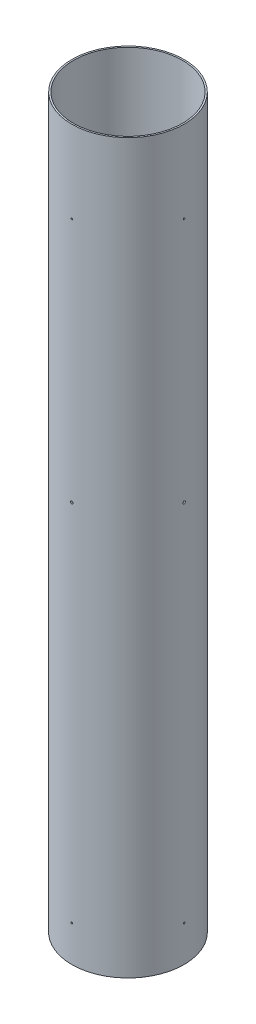
from build123d import *

# Parameters (mm, degrees)
SKETCH1_R           = 78.359
SKETCH1_R_2         = 76.1746
BOSS_EXTRUDE1_DEPTH = 1016
SKETCH3_R           = 1.750000056
SKETCH3_R_2         = 1.0922
CUT_EXTRUDE1_DEPTH  = 1023.025570014
CIRPATTERN1_COUNT   = 4


with BuildPart() as part:
    # Sketch1 → Boss-Extrude1 (new body)
    with BuildSketch(Plane(origin=(0, 0, 0), x_dir=(1, 0, 0), z_dir=(0, 1, 0))):
        Circle(SKETCH1_R)
        Circle(SKETCH1_R_2, mode=Mode.SUBTRACT)
    extrude(amount=BOSS_EXTRUDE1_DEPTH)

    # Sketch3 → Cut-Extrude1 (cut, through all)
    with BuildSketch(Plane.XY):
        with Locations((0, 558.8)):
            Circle(SKETCH3_R)
        with Locations((0, 50.184872129)):
            Circle(SKETCH3_R_2)
        with Locations((0, 901.7)):
            Circle(SKETCH3_R_2)
    cut_extrude1 = extrude(amount=-CUT_EXTRUDE1_DEPTH, mode=Mode.SUBTRACT)

    # CirPattern1: Cut-Extrude1 ×4 about axis
    cirpattern1_axis = Axis((0, 1016, 0), (0, -1, 0))
    for i in range(1, CIRPATTERN1_COUNT):
        add(cut_extrude1.rotate(cirpattern1_axis, i * 360 / CIRPATTERN1_COUNT), mode=Mode.SUBTRACT)


solid = part.part
